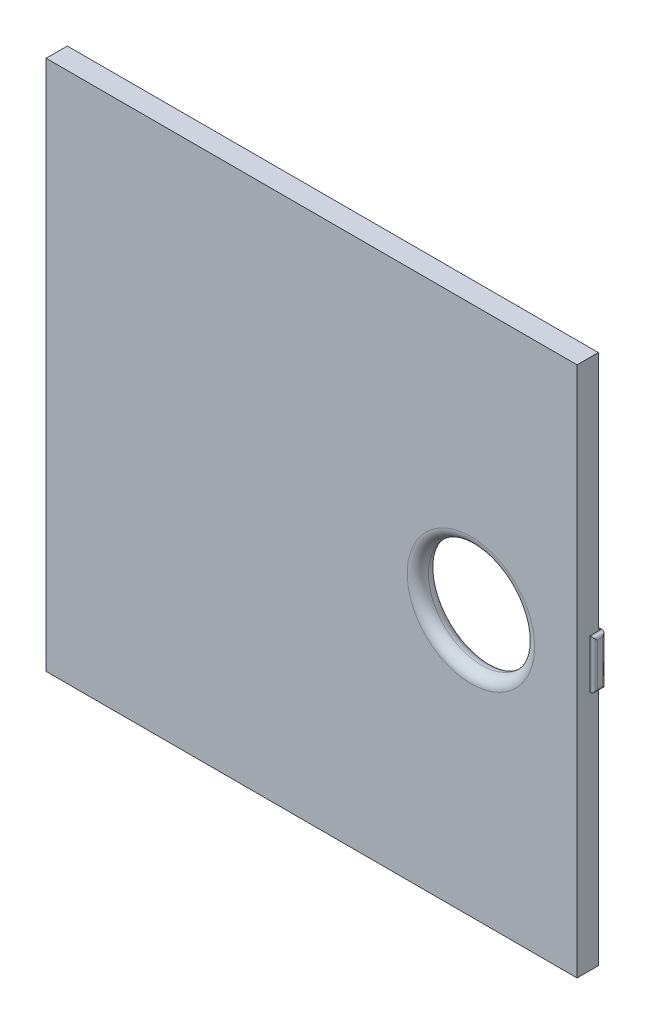
from build123d import *

# Parameters (mm, degrees)
SKETCH1_W                = 50
SKETCH1_H                = 50
BOSS_EXTRUDE1_DEPTH      = 2
BOSS_EXTRUDE2_DEPTH      = 1.2
BOSS_EXTRUDE2_DEPTH_BACK = 1.2
SKETCH3_W                = 1.1
SKETCH3_H                = 2.6
FILLET1_R                = 1
BOSS_EXTRUDE3_DEPTH      = 0.4
BOSS_EXTRUDE3_DEPTH_BACK = 1.2
SKETCH6_W                = 1.1
SKETCH6_H                = 4.6
FILLET2_R                = 0.3
FILLET3_R                = 0.3
CUT_EXTRUDE1_REACH       = 38.287
SKETCH7_R                = 5
FILLET5_R                = 1


# Some blends are built 0.0001 mm under size
with BuildPart() as part:
    # Sketch1 → Boss-Extrude1 (new body)
    with BuildSketch(Plane.XY):
        Rectangle(SKETCH1_W, SKETCH1_H)
    extrude(amount=BOSS_EXTRUDE1_DEPTH)

    # Sketch3 → Boss-Extrude2 (add, two sides: drawn at the far end of the back side and taken through both)
    with BuildSketch(Plane.ZY.offset(25).offset(-BOSS_EXTRUDE2_DEPTH_BACK)):
        with Locations((0.25, 19.8)):
            Rectangle(SKETCH3_W, SKETCH3_H)
        with Locations((0.25, -19.8)):
            Rectangle(SKETCH3_W, SKETCH3_H)
    extrude(amount=BOSS_EXTRUDE2_DEPTH + BOSS_EXTRUDE2_DEPTH_BACK)

    # Fillet1
    # the kernel refuses this fillet: 1 mm, written as the material it adds along each edge
    with BuildSketch(Plane(origin=(-23.8, 21.1, 0), x_dir=(0, 1, 0), z_dir=(-1, 0, 0)), Plane(origin=(-25, 18.5, 0), x_dir=(0, -1, 0), z_dir=(1, 0, 0))) as fillet1_piece_1:
        with BuildLine():
            CenterArc((0.714142843, 1), FILLET1_R, 224.427004001, 45.572995999)
            Line((0, 0.3), (-0.014282857, 0.286))
            ThreePointArc((-0.014282857, 0.286), (-0.02, 0.15), (-0.02, 0))
            Line((-0.02, 0), (0, -0.02))
            Line((0, -0.02), (0.714142843, -0.02))
            Line((0.714142843, -0.02), (0.714142843, 0))
        make_face()
    extrude(amount=1.2)
    with BuildSketch(Plane(origin=(-23.8, -21.1, 0), x_dir=(0, -1, 0), z_dir=(-1, 0, 0)), Plane(origin=(-25, -18.5, 0), x_dir=(0, 1, 0), z_dir=(1, 0, 0))) as fillet1_piece_2:
        with BuildLine():
            CenterArc((0.714142843, -1), FILLET1_R, 90, 45.572995999)
            Line((0, -0.3), (-0.014282857, -0.286))
            ThreePointArc((-0.014282857, -0.286), (-0.02, -0.15), (-0.02, 0))
            Line((-0.02, 0), (0, 0.02))
            Line((0, 0.02), (0.714142843, 0.02))
            Line((0.714142843, 0.02), (0.714142843, 0))
        make_face()
    extrude(amount=1.2)
    with BuildSketch(Plane(origin=(-23.8, -18.5, 0), x_dir=(1, 0, 0), z_dir=(0, -1, 0))) as fillet1_piece_3:
        with BuildLine():
            CenterArc((0.714142843, -1), FILLET1_R, 90, 45.572995999)
            Line((0, -0.3), (-0.014282857, -0.286))
            ThreePointArc((-0.014282857, -0.286), (-0.02, -0.15), (-0.02, 0))
            Line((-0.02, 0), (0, 0.02))
            Line((0, 0.02), (0.714142843, 0.02))
            Line((0.714142843, 0.02), (0.714142843, 0))
        make_face()
    extrude(amount=2.6)
    with BuildSketch(Plane(origin=(-23.8, 18.5, 0), x_dir=(1, 0, 0), z_dir=(0, 1, 0))) as fillet1_piece_4:
        with BuildLine():
            CenterArc((0.714142843, 1), FILLET1_R, 224.427004001, 45.572995999)
            Line((0, 0.3), (-0.014282857, 0.286))
            ThreePointArc((-0.014282857, 0.286), (-0.02, 0.15), (-0.02, 0))
            Line((-0.02, 0), (0, -0.02))
            Line((0, -0.02), (0.714142843, -0.02))
            Line((0.714142843, -0.02), (0.714142843, 0))
        make_face()
    extrude(amount=2.6)
    with BuildSketch(Plane(origin=(-25, -21.1, 0.8), x_dir=(0, 0, 1), z_dir=(0, 1, 0))) as fillet1_piece_5:
        with BuildLine():
            CenterArc((FILLET1_R, -FILLET1_R), FILLET1_R, 90, 90)
            Line((0, -FILLET1_R), (-FILLET1_R * 0.02, -FILLET1_R))
            Line((-FILLET1_R * 0.02, -FILLET1_R), (-FILLET1_R * 0.02, FILLET1_R * 0.02))
            Line((-FILLET1_R * 0.02, FILLET1_R * 0.02), (FILLET1_R, FILLET1_R * 0.02))
            Line((FILLET1_R, FILLET1_R * 0.02), (FILLET1_R, 0))
        make_face()
    extrude(amount=2.6)
    with BuildSketch(Plane(origin=(-25, 21.1, 0.8), x_dir=(0, 0, 1), z_dir=(0, -1, 0))) as fillet1_piece_6:
        with BuildLine():
            CenterArc((FILLET1_R, FILLET1_R), FILLET1_R, 180, 90)
            Line((0, FILLET1_R), (-FILLET1_R * 0.02, FILLET1_R))
            Line((-FILLET1_R * 0.02, FILLET1_R), (-FILLET1_R * 0.02, -FILLET1_R * 0.02))
            Line((-FILLET1_R * 0.02, -FILLET1_R * 0.02), (FILLET1_R, -FILLET1_R * 0.02))
            Line((FILLET1_R, -FILLET1_R * 0.02), (FILLET1_R, 0))
        make_face()
    extrude(amount=2.6)
    with BuildSketch(Plane(origin=(-22.014642893, 21.1, 0), x_dir=(0, 1, 0), z_dir=(-1, 0, 0))) as fillet1_piece_7a_section:
        with BuildLine():
            CenterArc((0.714142843, 1), FILLET1_R, 224.427004001, 45.572995999)
            Line((0, 0.3), (-0.014282857, 0.286))
            ThreePointArc((-0.014282857, 0.286), (-0.02, 0.15), (-0.02, 0))
            Line((-0.02, 0), (0, -0.02))
            Line((0, -0.02), (0.714142843, -0.02))
            Line((0.714142843, -0.02), (0.714142843, 0))
        make_face()
    fillet1_piece_7a = extrude(amount=2.985357107, mode=Mode.PRIVATE)
    fillet1_piece_7a = split(fillet1_piece_7a, bisect_by=Plane(origin=(-23.8, 21.290996304, -0.074177971), z_dir=(1, 0, 0)), keep=Keep.TOP, mode=Mode.PRIVATE)
    with BuildSketch(Plane(origin=(-23.8, 18.5, 0), x_dir=(1, 0, 0), z_dir=(0, 1, 0))) as fillet1_piece_7b_section:
        with BuildLine():
            CenterArc((0.714142843, 1), FILLET1_R, 224.427004001, 45.572995999)
            Line((0, 0.3), (-0.014282857, 0.286))
            ThreePointArc((-0.014282857, 0.286), (-0.02, 0.15), (-0.02, 0))
            Line((-0.02, 0), (0, -0.02))
            Line((0, -0.02), (0.714142843, -0.02))
            Line((0.714142843, -0.02), (0.714142843, 0))
        make_face()
    fillet1_piece_7b = extrude(amount=4.385357107, mode=Mode.PRIVATE)
    fillet1_piece_7b = split(fillet1_piece_7b, bisect_by=Plane(origin=(-23.609003696, 21.1, -0.074177971), z_dir=(0, 1, 0)), keep=Keep.TOP, mode=Mode.PRIVATE)
    fillet1_piece_7 = fillet1_piece_7a & fillet1_piece_7b
    add(fillet1_piece_7)
    with BuildSketch(Plane(origin=(-23.8, 16.714642893, 0), x_dir=(1, 0, 0), z_dir=(0, 1, 0))) as fillet1_piece_8a_section:
        with BuildLine():
            CenterArc((0.714142843, 1), FILLET1_R, 224.427004001, 45.572995999)
            Line((0, 0.3), (-0.014282857, 0.286))
            ThreePointArc((-0.014282857, 0.286), (-0.02, 0.15), (-0.02, 0))
            Line((-0.02, 0), (0, -0.02))
            Line((0, -0.02), (0.714142843, -0.02))
            Line((0.714142843, -0.02), (0.714142843, 0))
        make_face()
    fillet1_piece_8a = extrude(amount=4.385357107, mode=Mode.PRIVATE)
    fillet1_piece_8a = split(fillet1_piece_8a, bisect_by=Plane(origin=(-23.609003696, 18.5, -0.074177971), z_dir=(0, -1, 0)), keep=Keep.TOP, mode=Mode.PRIVATE)
    with BuildSketch(Plane(origin=(-25, 18.5, 0), x_dir=(0, -1, 0), z_dir=(1, 0, 0))) as fillet1_piece_8b_section:
        with BuildLine():
            CenterArc((0.714142843, 1), FILLET1_R, 224.427004001, 45.572995999)
            Line((0, 0.3), (-0.014282857, 0.286))
            ThreePointArc((-0.014282857, 0.286), (-0.02, 0.15), (-0.02, 0))
            Line((-0.02, 0), (0, -0.02))
            Line((0, -0.02), (0.714142843, -0.02))
            Line((0.714142843, -0.02), (0.714142843, 0))
        make_face()
    fillet1_piece_8b = extrude(amount=2.985357107, mode=Mode.PRIVATE)
    fillet1_piece_8b = split(fillet1_piece_8b, bisect_by=Plane(origin=(-23.8, 18.309003696, -0.074177971), z_dir=(1, 0, 0)), keep=Keep.TOP, mode=Mode.PRIVATE)
    fillet1_piece_8 = fillet1_piece_8a & fillet1_piece_8b
    add(fillet1_piece_8)
    with BuildSketch(Plane(origin=(-23.8, -18.5, 0), x_dir=(1, 0, 0), z_dir=(0, -1, 0))) as fillet1_piece_9a_section:
        with BuildLine():
            CenterArc((0.714142843, -1), FILLET1_R, 90, 45.572995999)
            Line((0, -0.3), (-0.014282857, -0.286))
            ThreePointArc((-0.014282857, -0.286), (-0.02, -0.15), (-0.02, 0))
            Line((-0.02, 0), (0, 0.02))
            Line((0, 0.02), (0.714142843, 0.02))
            Line((0.714142843, 0.02), (0.714142843, 0))
        make_face()
    fillet1_piece_9a = extrude(amount=4.385357107, mode=Mode.PRIVATE)
    fillet1_piece_9a = split(fillet1_piece_9a, bisect_by=Plane(origin=(-23.609003696, -21.1, -0.074177971), z_dir=(0, -1, 0)), keep=Keep.TOP, mode=Mode.PRIVATE)
    with BuildSketch(Plane(origin=(-22.014642893, -21.1, 0), x_dir=(0, -1, 0), z_dir=(-1, 0, 0))) as fillet1_piece_9b_section:
        with BuildLine():
            CenterArc((0.714142843, -1), FILLET1_R, 90, 45.572995999)
            Line((0, -0.3), (-0.014282857, -0.286))
            ThreePointArc((-0.014282857, -0.286), (-0.02, -0.15), (-0.02, 0))
            Line((-0.02, 0), (0, 0.02))
            Line((0, 0.02), (0.714142843, 0.02))
            Line((0.714142843, 0.02), (0.714142843, 0))
        make_face()
    fillet1_piece_9b = extrude(amount=2.985357107, mode=Mode.PRIVATE)
    fillet1_piece_9b = split(fillet1_piece_9b, bisect_by=Plane(origin=(-23.8, -21.290996304, -0.074177971), z_dir=(1, 0, 0)), keep=Keep.TOP, mode=Mode.PRIVATE)
    fillet1_piece_9 = fillet1_piece_9a & fillet1_piece_9b
    add(fillet1_piece_9)
    with BuildSketch(Plane(origin=(-25, -18.5, 0), x_dir=(0, 1, 0), z_dir=(1, 0, 0))) as fillet1_piece_10a_section:
        with BuildLine():
            CenterArc((0.714142843, -1), FILLET1_R, 90, 45.572995999)
            Line((0, -0.3), (-0.014282857, -0.286))
            ThreePointArc((-0.014282857, -0.286), (-0.02, -0.15), (-0.02, 0))
            Line((-0.02, 0), (0, 0.02))
            Line((0, 0.02), (0.714142843, 0.02))
            Line((0.714142843, 0.02), (0.714142843, 0))
        make_face()
    fillet1_piece_10a = extrude(amount=2.985357107, mode=Mode.PRIVATE)
    fillet1_piece_10a = split(fillet1_piece_10a, bisect_by=Plane(origin=(-23.8, -18.309003696, -0.074177971), z_dir=(1, 0, 0)), keep=Keep.TOP, mode=Mode.PRIVATE)
    with BuildSketch(Plane(origin=(-23.8, -16.714642893, 0), x_dir=(1, 0, 0), z_dir=(0, -1, 0))) as fillet1_piece_10b_section:
        with BuildLine():
            CenterArc((0.714142843, -1), FILLET1_R, 90, 45.572995999)
            Line((0, -0.3), (-0.014282857, -0.286))
            ThreePointArc((-0.014282857, -0.286), (-0.02, -0.15), (-0.02, 0))
            Line((-0.02, 0), (0, 0.02))
            Line((0, 0.02), (0.714142843, 0.02))
            Line((0.714142843, 0.02), (0.714142843, 0))
        make_face()
    fillet1_piece_10b = extrude(amount=4.385357107, mode=Mode.PRIVATE)
    fillet1_piece_10b = split(fillet1_piece_10b, bisect_by=Plane(origin=(-23.609003696, -18.5, -0.074177971), z_dir=(0, 1, 0)), keep=Keep.TOP, mode=Mode.PRIVATE)
    fillet1_piece_10 = fillet1_piece_10a & fillet1_piece_10b
    add(fillet1_piece_10)

    # Sketch6 → Boss-Extrude3 (add, two sides: drawn at the far end of the back side and taken through both)
    with BuildSketch(Plane(origin=(25, 0, 0), x_dir=(0, 0, -1), z_dir=(1, 0, 0)).offset(-BOSS_EXTRUDE3_DEPTH_BACK)):
        with Locations((-0.25, 0)):
            Rectangle(SKETCH6_W, SKETCH6_H)
    extrude(amount=BOSS_EXTRUDE3_DEPTH + BOSS_EXTRUDE3_DEPTH_BACK)

    # Fillet2
    fillet2_edges = [part.edges().sort_by_distance(p)[0] for p in [
        (25.4, 2.3, 0.25),
        (25.4, -2.3, 0.25),
        (25.4, 0, 0.8),
        (25.4, 0, -0.3),
    ]]
    fillet(fillet2_edges, radius=FILLET2_R)

    # Fillet3
    fillet3_edges = [part.edges().sort_by_distance(p)[0] for p in [
        (24.4, -2.3, 0),
        (24.4, 2.3, 0),
        (23.8, 0, 0),
    ]]
    fillet(fillet3_edges, radius=FILLET3_R - 0.0001)  # a hair under: the kernel refuses the full size

    # Sketch7 → Cut-Extrude1 (cut, up to next)
    with BuildSketch(Plane.XY.offset(2), mode=Mode.PRIVATE) as cut_extrude1_sk1:
        with Locations((15, 0)):
            Circle(SKETCH7_R)
    cut_extrude1_tool1 = extrude(cut_extrude1_sk1.sketch, amount=-CUT_EXTRUDE1_REACH, mode=Mode.PRIVATE) & part.part
    add(cut_extrude1_tool1.solids().sort_by_distance((15, 0, 2))[0], mode=Mode.SUBTRACT)

    # Fillet5
    fillet5_edges = [part.edges().sort_by_distance(p)[0] for p in [
        (10, 0, 2),
        (10, 0, 0),
    ]]
    fillet(fillet5_edges, radius=FILLET5_R - 0.0001)  # a hair under: the kernel refuses the full size


solid = part.part
